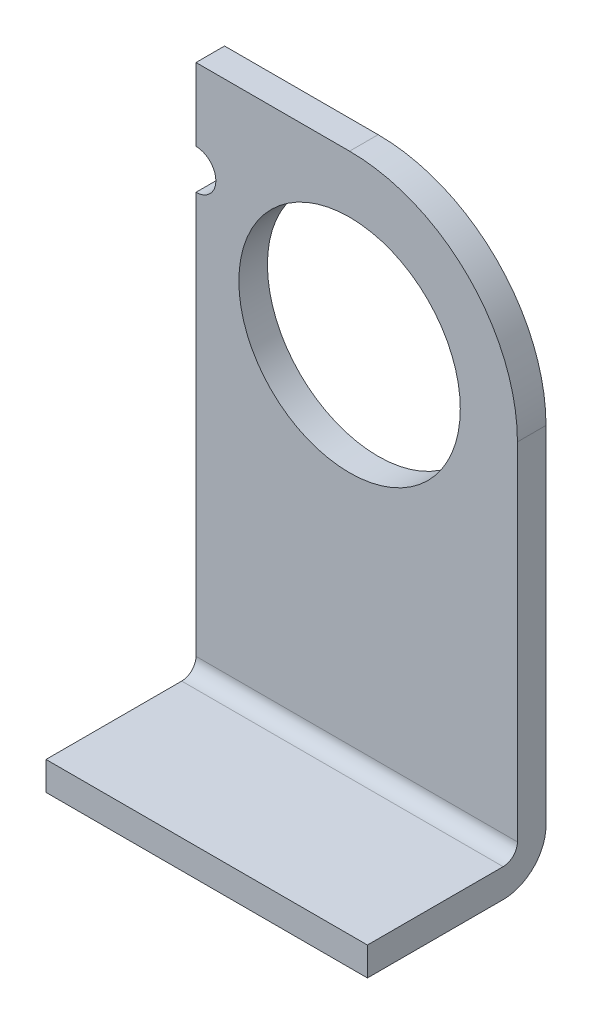
from build123d import *

# Parameters (mm, degrees)
SKETCH1_W               = 22.5
SKETCH1_H               = 12.5
BOSS_EXTRUDE1_DEPTH     = 2
SKETCH2_W               = 22.5
SKETCH2_H               = 37
BOSS_EXTRUDE2_DEPTH     = 2
FILLET1_R               = 1
FILLET2_R               = 3
SKETCH5_R               = 7.75
CUT_EXTRUDE1_DEPTH      = 2
CUT_EXTRUDE2_DEPTH      = 47.72793597
CUT_EXTRUDE2_DEPTH_BACK = 2
CUT_EXTRUDE3_DEPTH      = 47.72793597
CUT_EXTRUDE3_DEPTH_BACK = 2


with BuildPart() as part:
    # Sketch1 → Boss-Extrude1 (new body)
    with BuildSketch(Plane(origin=(0, 0, 0), x_dir=(1, 0, 0), z_dir=(0, 1, 0))):
        with Locations((11.25, 6.25)):
            Rectangle(SKETCH1_W, SKETCH1_H)
    extrude(amount=BOSS_EXTRUDE1_DEPTH)

    # Sketch2 → Boss-Extrude2 (add)
    with BuildSketch(Plane(origin=(0, 0, -12.5), x_dir=(-1, 0, 0), z_dir=(0, 0, -1))):
        with Locations((-11.25, 20.5)):
            Rectangle(SKETCH2_W, SKETCH2_H)
    extrude(amount=-BOSS_EXTRUDE2_DEPTH)

    # Fillet1
    fillet1_edges = [part.edges().sort_by_distance(p)[0] for p in [
        (11.25, 2, -10.5),
    ]]
    fillet(fillet1_edges, radius=FILLET1_R)

    # Fillet2
    fillet2_edges = [part.edges().sort_by_distance(p)[0] for p in [
        (11.25, 0, -12.5),
    ]]
    fillet(fillet2_edges, radius=FILLET2_R)

    # Sketch5 → Cut-Extrude1 (cut)
    with BuildSketch(Plane(origin=(0, 0, -12.5), x_dir=(-1, 0, 0), z_dir=(0, 0, -1))):
        with Locations((-10.75, 27.25)):
            Circle(SKETCH5_R)
    extrude(amount=-CUT_EXTRUDE1_DEPTH, mode=Mode.SUBTRACT)

    # Sketch6 → Cut-Extrude2 (cut, two sides: drawn at the far end of the back side and taken through both)
    with BuildSketch(Plane(origin=(0, 0, -12.5), x_dir=(-1, 0, 0), z_dir=(0, 0, -1)).offset(-CUT_EXTRUDE2_DEPTH_BACK)):
        with BuildLine():
            Line((-22.5, -64.213181868), (-22.5, 27.25))
            ThreePointArc((-22.5, 27.25), (-19.058504679, 35.558504679), (-10.75, 39))
            Line((-10.75, 39), (80.713181868, 39))
            Line((80.713181868, 39), (-48.635290387, 168.348472255))
            Line((-48.635290387, 168.348472255), (-151.848472255, 65.135290387))
            Line((-151.848472255, 65.135290387), (-22.5, -64.213181868))
        make_face()
    extrude(amount=CUT_EXTRUDE2_DEPTH + CUT_EXTRUDE2_DEPTH_BACK, mode=Mode.SUBTRACT)

    # Sketch7 → Cut-Extrude3 (cut, two sides: drawn at the far end of the back side and taken through both)
    with BuildSketch(Plane(origin=(0, 0, -12.5), x_dir=(-1, 0, 0), z_dir=(0, 0, -1)).offset(-CUT_EXTRUDE3_DEPTH_BACK)):
        with BuildLine():
            Line((91.395776572, 33.912654142), (0, 33.912654142))
            ThreePointArc((0, 33.912654142), (-1.389365971, 32.523288171), (0, 31.1339222))
            Line((0, 31.1339222), (91.395776572, 31.1339222))
            Line((91.395776572, 31.1339222), (274.187329717, 31.1339222))
            Line((274.187329717, 31.1339222), (274.187329717, 33.912654142))
            Line((274.187329717, 33.912654142), (91.395776572, 33.912654142))
        make_face()
    extrude(amount=CUT_EXTRUDE3_DEPTH + CUT_EXTRUDE3_DEPTH_BACK, mode=Mode.SUBTRACT)


solid = part.part
